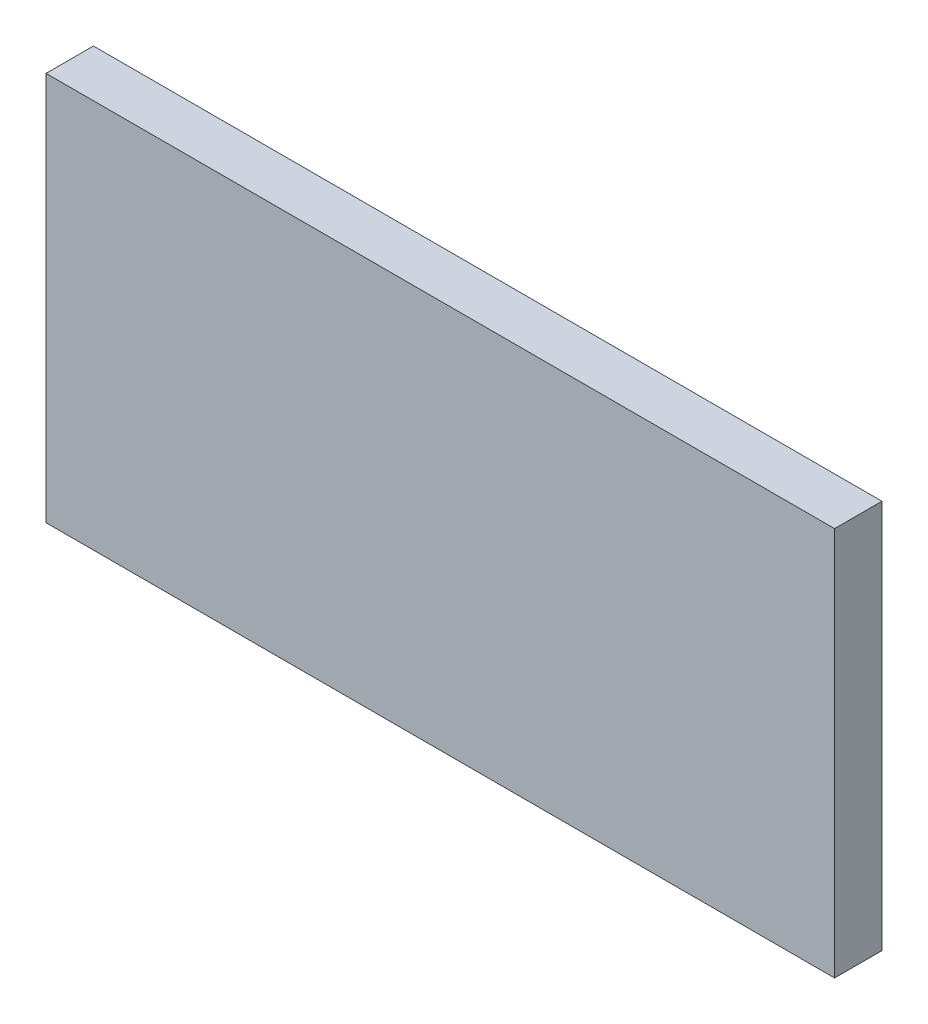
from build123d import *

# Parameters (mm, degrees)
SKETCH1_W           = 308.405777755
SKETCH1_H           = 152.207057826
BOSS_EXTRUDE1_DEPTH = 18.542


with BuildPart() as part:
    # Sketch1 → Boss-Extrude1 (new body)
    with BuildSketch(Plane.XY):
        with Locations((2.479951548, 1.603785389)):
            Rectangle(SKETCH1_W, SKETCH1_H)
    extrude(amount=-BOSS_EXTRUDE1_DEPTH)


solid = part.part
